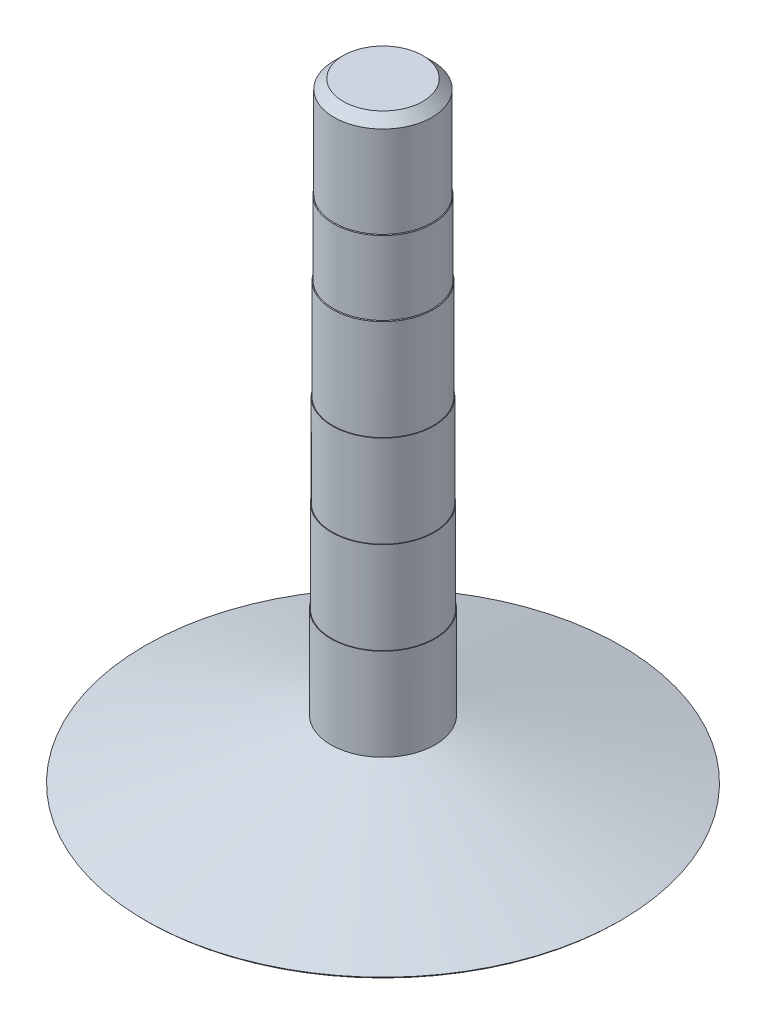
from build123d import *

# Parameters (mm, degrees)
CHAMFER1_SIZE   = 0.75
CHAMFER1_SIZE_2 = 0.597274803


with BuildPart() as part:
    # Sketch1 → Revolve1 (revolve)
    with BuildSketch(Plane.XY):
        Polygon((-4.2, -12.5), (-4.25, -12.5), (-4.25, -20), (-20, -25), (0, -25), (0, 25), (-4, 25), (-4, 17.5), (-4.05, 17.5), (-4.05, 10), (-4.1, 10), (-4.1, 2.5), (-4.15, 2.5), (-4.15, -5), (-4.2, -5), align=None)
    revolve(axis=Axis((0, 37.271191626, 0), (0, -1, 0)))

    # Chamfer1
    # the kernel refuses this chamfer: 0.75, 0.597274803 mm, written as the material it adds along each edge
    with BuildSketch(Plane(origin=(0, 10, 0), x_dir=(-1, 0, 0), z_dir=(0, 0, 1))) as chamfer1_piece_1_section:
        Polygon((4.05, -CHAMFER1_SIZE), (4.05 + CHAMFER1_SIZE, 0), (4.05, 0), align=None)
    chamfer1_piece_1 = revolve(axis=Axis((0, 10, 0), (0, -1, 0)), mode=Mode.PRIVATE)
    chamfer1_piece_1 = chamfer1_piece_1 & Plane(origin=(0, 10.727876621, 0), x_dir=(-1, 0, 0), z_dir=(0, -1, 0)) * Cylinder(4.1, 20, mode=Mode.PRIVATE)
    add(chamfer1_piece_1)
    # the kernel refuses this chamfer: 0.75, 0.597274803 mm, written as the material it takes off along each edge
    with BuildSketch(Plane(origin=(0, 25, 0), x_dir=(-1, 0, 0), z_dir=(0, 0, 1))) as chamfer1_2_piece_1:
        Polygon((4, CHAMFER1_SIZE), (4 - CHAMFER1_SIZE, 0), (4, 0), align=None)
    revolve(axis=Axis((0, 25, 0), (0, -1, 0)), mode=Mode.SUBTRACT)
    with BuildSketch(Plane(origin=(0, 17.5, 0), x_dir=(-1, 0, 0), z_dir=(0, 0, 1))) as chamfer1_2_piece_2_section:
        Polygon((4.05, CHAMFER1_SIZE), (4.05 - CHAMFER1_SIZE, 0), (4.05, 0), align=None)
    chamfer1_2_piece_2 = revolve(axis=Axis((0, 17.5, 0), (0, -1, 0)), mode=Mode.PRIVATE)
    chamfer1_2_piece_2 = chamfer1_2_piece_2 - Plane(origin=(0, 16.772104401, 0), x_dir=(-1, 0, 0), z_dir=(0, -1, 0)) * Cylinder(4, 17, mode=Mode.PRIVATE)
    add(chamfer1_2_piece_2, mode=Mode.SUBTRACT)
    with BuildSketch(Plane(origin=(0, -25, 0), x_dir=(-1, 0, 0), z_dir=(0, 0, 1))) as chamfer1_2_piece_3:
        Polygon((20 - CHAMFER1_SIZE_2 * 0.953124266375, -CHAMFER1_SIZE_2 * 0.302579132183), (20 - CHAMFER1_SIZE, 0), (20, 0), align=None)
    revolve(axis=Axis((0, -25, 0), (0, -1, 0)), mode=Mode.SUBTRACT)


solid = part.part
